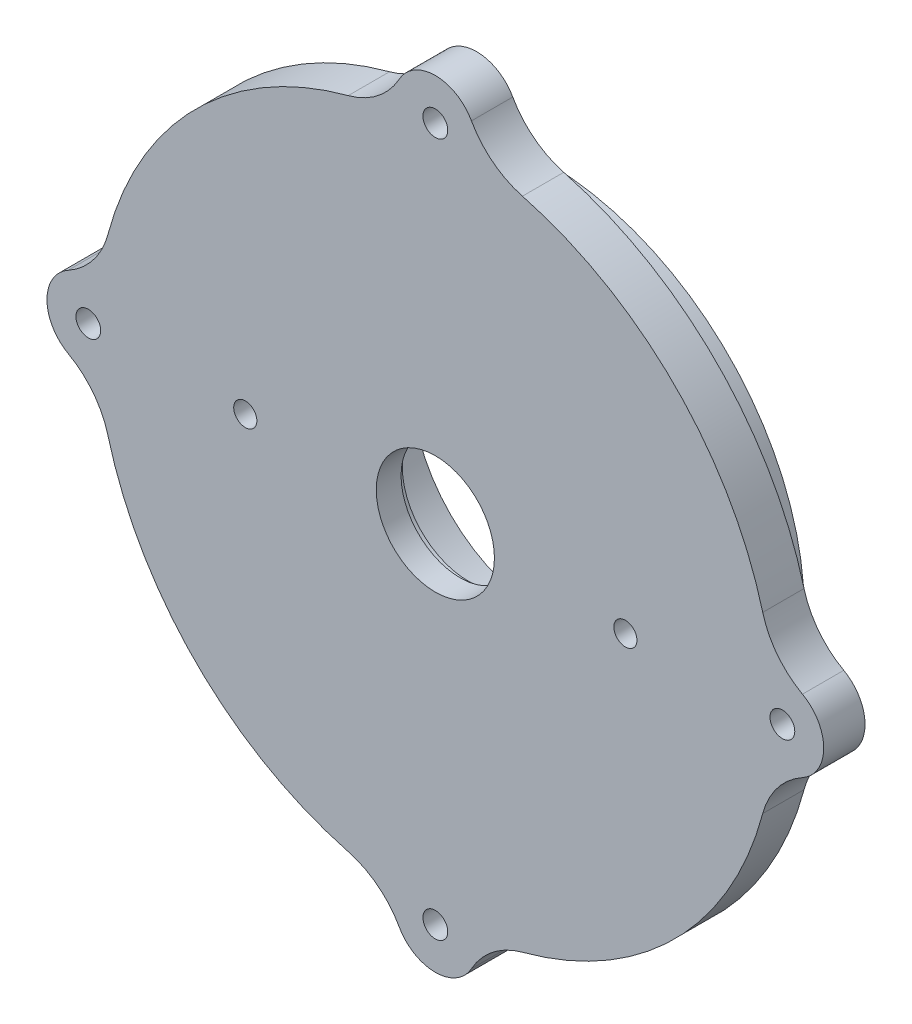
from build123d import *

# Parameters (mm, degrees)
IZIM1_R                       = 22.5
IZIM1_R_2                     = 16.1
Y_KSEKLIK_EKSTR_ZYON1_DEPTH   = 8.25
IZIM1_R_3                     = 31.4
IZIM1_R_4                     = 29.425
Y_KSEKLIK_EKSTR_ZYON1_2_DEPTH = 8.25
IZIM2_R                       = 1.5
IZIM2_R_2                     = 7.15
Y_KSEKLIK_EKSTR_ZYON2_DEPTH   = 5
IZIM7_R                       = 16.1
KES_EKSTR_ZYON2_DEPTH         = 1
IZIM8_R                       = 8
KES_EKSTR_ZYON3_DEPTH         = 1
IZIM9_R                       = 1.4
KES_EKSTR_ZYON4_DEPTH         = 25.4


with BuildPart() as part:
    # Çizim1 → Yükseklik-Ekstrüzyon1 (new body)
    with BuildSketch(Plane.XY):
        Circle(IZIM1_R)
        Circle(IZIM1_R_2, mode=Mode.SUBTRACT)
    extrude(amount=Y_KSEKLIK_EKSTR_ZYON1_DEPTH)



with BuildPart() as body_2:
    # Çizim1 → Y_kseklik-Ekstr_zyon1 2 (new body)
    with BuildSketch(Plane.XY):
        Circle(IZIM1_R_3)
        Circle(IZIM1_R_4, mode=Mode.SUBTRACT)
    extrude(amount=Y_KSEKLIK_EKSTR_ZYON1_2_DEPTH)


with BuildPart() as part_1:
    add(part.part)

    add(body_2.part)  # Yükseklik-Ekstrüzyon2 merges body 2
    # Çizim2 → Yükseklik-Ekstrüzyon2 (add)
    with BuildSketch(Plane.XY.offset(8.25)):
        with BuildLine():
            ThreePointArc((-10.540830255, 39.621848739), (-28.991378029, 28.991378029), (-39.621848739, 10.540830255))
            ThreePointArc((-39.621848739, 10.540830255), (-41.396931543, 6.966269622), (-44.428571429, 4.370588155))
            ThreePointArc((-44.428571429, 4.370588155), (-47, 0), (-44.428571429, -4.370588155))
            ThreePointArc((-44.428571429, -4.370588155), (-41.396931543, -6.966269622), (-39.621848739, -10.540830255))
            ThreePointArc((-39.621848739, -10.540830255), (-28.991378029, -28.991378029), (-10.540830255, -39.621848739))
            ThreePointArc((-10.540830255, -39.621848739), (-6.966269622, -41.396931543), (-4.370588155, -44.428571429))
            ThreePointArc((-4.370588155, -44.428571429), (0, -47), (4.370588155, -44.428571429))
            ThreePointArc((4.370588155, -44.428571429), (6.966269622, -41.396931543), (10.540830255, -39.621848739))
            ThreePointArc((10.540830255, -39.621848739), (28.991378029, -28.991378029), (39.621848739, -10.540830255))
            ThreePointArc((39.621848739, -10.540830255), (41.396931543, -6.966269622), (44.428571429, -4.370588155))
            ThreePointArc((44.428571429, -4.370588155), (47, 0), (44.428571429, 4.370588155))
            ThreePointArc((44.428571429, 4.370588155), (41.396931543, 6.966269622), (39.621848739, 10.540830255))
            ThreePointArc((39.621848739, 10.540830255), (28.991378029, 28.991378029), (10.540830255, 39.621848739))
            ThreePointArc((10.540830255, 39.621848739), (6.966269622, 41.396931543), (4.370588155, 44.428571429))
            ThreePointArc((4.370588155, 44.428571429), (0, 47), (-4.370588155, 44.428571429))
            ThreePointArc((-4.370588155, 44.428571429), (-6.966269622, 41.396931543), (-10.540830255, 39.621848739))
        make_face()
        with Locations((0, 42)):
            Circle(IZIM2_R, mode=Mode.SUBTRACT)
        with Locations((42, 0)):
            Circle(IZIM2_R, mode=Mode.SUBTRACT)
        with Locations((0, -42)):
            Circle(IZIM2_R, mode=Mode.SUBTRACT)
        with Locations((-42, 0)):
            Circle(IZIM2_R, mode=Mode.SUBTRACT)
        Circle(IZIM2_R_2, mode=Mode.SUBTRACT)
    extrude(amount=Y_KSEKLIK_EKSTR_ZYON2_DEPTH)

    # Çizim7 → Kes-Ekstrüzyon2 (cut)
    with BuildSketch(Plane(origin=(0, 0, 8.25), x_dir=(-1, 0, 0), z_dir=(0, 0, -1))):
        Circle(IZIM7_R)
    extrude(amount=-KES_EKSTR_ZYON2_DEPTH, mode=Mode.SUBTRACT)

    # Çizim8 → Kes-Ekstrüzyon3 (cut)
    with BuildSketch(Plane(origin=(0, 0, 9.25), x_dir=(-1, 0, 0), z_dir=(0, 0, -1))):
        Circle(IZIM8_R)
    extrude(amount=-KES_EKSTR_ZYON3_DEPTH, mode=Mode.SUBTRACT)

    # Çizim9 → Kes-Ekstrüzyon4 (cut)
    with BuildSketch(Plane.XY.offset(13.25)):
        with Locations((-23, 0)):
            Circle(IZIM9_R)
        with Locations((23, 0)):
            Circle(IZIM9_R)
    extrude(amount=-KES_EKSTR_ZYON4_DEPTH, mode=Mode.SUBTRACT)


solid = part_1.part
